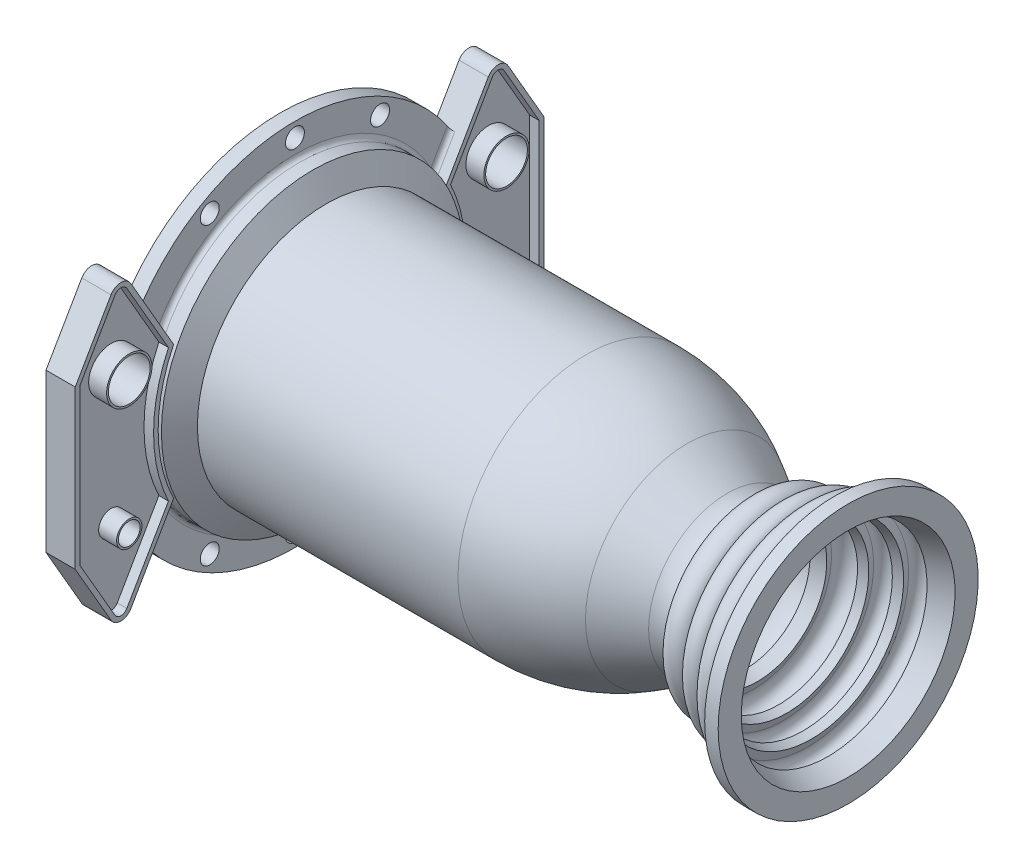
from build123d import *
from build123d.topology import SkipClean

# Parameters (mm, degrees)
BOSS_EXTRUDE1_DEPTH     = 16.256
CUT_EXTRUDE1_DEPTH      = 5.334
BOSS_EXTRUDE2_START     = -8.128
BOSS_EXTRUDE2_DEPTH     = 8.128
FILLET2_R               = 2.54
SKETCH9_R               = 5.275
CUT_EXTRUDE2_DEPTH      = 419.885269444
SKETCH10_R              = 11.6
SKETCH10_R_2            = 6.05
CUT_EXTRUDE3_DEPTH      = 417.321354466
BOSS_EXTRUDE3_START     = 10
SKETCH11_R              = 12.6
SKETCH11_R_2            = 11.6
SKETCH11_R_3            = 7.05
SKETCH11_R_4            = 6.05
BOSS_EXTRUDE3_DEPTH     = 10
CUT_EXTRUDE4_DEPTH      = 404.084600433
CUT_EXTRUDE4_DEPTH_BACK = 404.084600433
SKETCH17_W              = 85
SKETCH17_H              = 190


with BuildPart() as part:
    # Sketch3 → Revolve1 (revolve)
    with BuildSketch(Plane.XY):
        with BuildLine():
            Line((0, 71.5011717), (144.934666475, 71.5011717))
            ThreePointArc((144.934666475, 71.5011717), (173.892574508, 67.688769671), (200.877042723, 56.51141211))
            Line((200.877042723, 56.51141211), (223.127154881, 43.665279514))
            ThreePointArc((223.127154881, 43.665279514), (227.625034583, 41.721337074), (232.448772375, 40.860298318))
            add(Edge.make_bspline(
                [(232.448772375, 40.860298318), (234.86856203, 41.933657894), (240.173238318, 44.266655644), (251.176182965, 49.013937562), (265.440009786, 54.97345202), (282.448229164, 61.765962568), (299.354503113, 68.202057856), (316.156963457, 74.280596731), (332.857651733, 80.001884245), (346.685594207, 84.470267584), (357.704525634, 87.868146407), (363.182392167, 89.503083437), (365.9308663, 90.309661005)],
                knots=[0.492875979, 0.492875979, 0.492875979, 0.492875979, 0.492966882, 0.493074775, 0.493290561, 0.493506346, 0.493722132, 0.493937918, 0.494153704, 0.494369489, 0.494477382, 0.494585275, 0.494585275, 0.494585275, 0.494585275], degree=3))
            Line((365.9308663, 90.309661005), (367.338810321, 85.511985147))
            add(Edge.make_bspline(
                [(233.424633311, 35.822756061), (236.183141196, 37.049408729), (241.820242455, 39.531718175), (253.12775411, 44.410404122), (267.331680592, 50.344882311), (284.265598042, 57.10770533), (301.095145103, 63.51457761), (317.818383555, 69.564442688), (334.43732724, 75.257710839), (348.19495997, 79.703362784), (359.156425704, 83.083517043), (364.604957844, 84.709698506), (367.338810321, 85.511985147)],
                knots=[0.492862754, 0.492862754, 0.492862754, 0.492862754, 0.492966882, 0.493074775, 0.493290561, 0.493506346, 0.493722132, 0.493937918, 0.494153704, 0.494369489, 0.494477382, 0.494585275, 0.494585275, 0.494585275, 0.494585275], degree=3))
            ThreePointArc((233.424633311, 35.822756061), (226.800103593, 36.756276843), (220.627157517, 39.335150973))
            Line((220.627157517, 39.335150973), (198.377039169, 52.181287144))
            ThreePointArc((198.377039169, 52.181287144), (172.598474463, 62.859141831), (144.9346606, 66.5011717))
            Line((144.9346606, 66.5011717), (0, 66.5011717))
            Line((0, 66.5011717), (0, 71.5011717))
        make_face()
    revolve(axis=Axis((0, 0, 0), (1, 0, 0)))

    # Sketch4 → Revolve5 (revolve)
    with BuildSketch(Plane.XY):
        Polygon((-25.4, 66.5011717), (-25.4, 84.2011717), (-7.332348419, 84.2011717), (0, 71.5011717), (0, 66.5011717), align=None)
    revolve(axis=Axis((0, 0, 0), (1, 0, 0)))

    # Sketch6 → Boss-Extrude1 (add)
    with SkipClean():  # the faces are left unmerged after this step: merging them gives an invalid solid
        with BuildSketch(Plane.ZY.offset(25.4)):
            with BuildLine():
                Line((64.197098299, 17.35333995), (99.428641487, 78.37616278))
                ThreePointArc((99.428641487, 78.37616278), (104.927902801, 81.55116278), (110.427164115, 78.37616278))
                Line((110.427164115, 78.37616278), (130.327902801, 43.907072268))
                Line((130.327902801, 43.907072268), (130.327902801, -43.907072268))
                Line((130.327902801, -43.907072268), (110.427164115, -78.37616278))
                ThreePointArc((110.427164115, -78.37616278), (104.927902801, -81.55116278), (99.428641487, -78.37616278))
                Line((99.428641487, -78.37616278), (64.197098299, -17.35333995))
                ThreePointArc((64.197098299, -17.35333995), (66.5011717, 0), (64.197098299, 17.35333995))
            make_face()
            with BuildLine():
                Line((-64.197098299, -17.35333995), (-99.428641487, -78.37616278))
                ThreePointArc((-99.428641487, -78.37616278), (-104.927902801, -81.55116278), (-110.427164115, -78.37616278))
                Line((-110.427164115, -78.37616278), (-130.327902801, -43.907072268))
                Line((-130.327902801, -43.907072268), (-130.327902801, 43.907072268))
                Line((-130.327902801, 43.907072268), (-110.427164115, 78.37616278))
                ThreePointArc((-110.427164115, 78.37616278), (-104.927902801, 81.55116278), (-99.428641487, 78.37616278))
                Line((-99.428641487, 78.37616278), (-64.197098299, 17.35333995))
                ThreePointArc((-64.197098299, 17.35333995), (-66.5011717, 0), (-64.197098299, -17.35333995))
            make_face()
        extrude(amount=-BOSS_EXTRUDE1_DEPTH)

    # Sketch7 → Cut-Extrude1 (cut)
    with SkipClean():  # the faces are left unmerged after this step: merging them gives an invalid solid
        with BuildSketch(Plane(origin=(-9.144, 0, 0), x_dir=(0, 0, -1), z_dir=(1, 0, 0))):
            with BuildLine():
                Line((-78.462562562, 36.981848846), (-101.628346013, 77.10616278))
                ThreePointArc((-101.628346013, 77.10616278), (-104.927902801, 79.01116278), (-108.22745959, 77.10616278))
                Line((-108.22745959, 77.10616278), (-127.787902801, 43.226481319))
                Line((-127.787902801, 43.226481319), (-127.787902801, -43.226481319))
                Line((-127.787902801, -43.226481319), (-108.22745959, -77.10616278))
                ThreePointArc((-108.22745959, -77.10616278), (-104.927902801, -79.01116278), (-101.628346013, -77.10616278))
                Line((-101.628346013, -77.10616278), (-78.462562562, -36.981848846))
                ThreePointArc((-78.462562562, -36.981848846), (-86.7411717, 0), (-78.462562562, 36.981848846))
            make_face()
            with BuildLine():
                Line((101.628346013, -77.10616278), (78.462562562, -36.981848846))
                ThreePointArc((78.462562562, -36.981848846), (86.7411717, 0), (78.462562562, 36.981848846))
                Line((78.462562562, 36.981848846), (101.628346013, 77.10616278))
                ThreePointArc((101.628346013, 77.10616278), (104.927902801, 79.01116278), (108.22745959, 77.10616278))
                Line((108.22745959, 77.10616278), (127.787902801, 43.226481319))
                Line((127.787902801, 43.226481319), (127.787902801, -43.226481319))
                Line((127.787902801, -43.226481319), (108.22745959, -77.10616278))
                ThreePointArc((108.22745959, -77.10616278), (104.927902801, -79.01116278), (101.628346013, -77.10616278))
            make_face()
        extrude(amount=-CUT_EXTRUDE1_DEPTH, mode=Mode.SUBTRACT)

    # Sketch8 → Boss-Extrude2 (add)
    with SkipClean():  # the faces are left unmerged after this step: merging them gives an invalid solid
        with BuildSketch(Plane.ZY.offset(25.4).offset(BOSS_EXTRUDE2_START)):
            with BuildLine():
                Line((-75.592096587, 37.090055935), (-86.329826389, 55.688349511))
                ThreePointArc((-86.329826389, 55.688349511), (0, 102.7328146), (86.329826389, 55.688349511))
                Line((86.329826389, 55.688349511), (75.592096587, 37.090055935))
                ThreePointArc((75.592096587, 37.090055935), (0, 84.2011717), (-75.592096587, 37.090055935))
            make_face()
            with BuildLine():
                Line((86.329826389, -55.688349511), (75.592096587, -37.090055935))
                ThreePointArc((75.592096587, -37.090055935), (0, -84.2011717), (-75.592096587, -37.090055935))
                Line((-75.592096587, -37.090055935), (-86.329826389, -55.688349511))
                ThreePointArc((-86.329826389, -55.688349511), (0, -102.7328146), (86.329826389, -55.688349511))
            make_face()
        extrude(amount=BOSS_EXTRUDE2_DEPTH)

    # Fillet2
    fillet2_edges = [part.edges().sort_by_distance(p)[0] for p in [
        (-17.272, 46.389202723, 80.960961488),
        (-17.272, 71.459301297, 44.535441771),
        (-17.272, 46.389202723, -80.960961488),
        (-17.272, -46.389202723, -80.960961488),
        (-17.272, -84.2011717, 0),
        (-17.272, -46.389202723, 80.960961488),
    ]]
    fillet(fillet2_edges, radius=FILLET2_R)

    # Sketch9 → Cut-Extrude2 (cut, through all)
    with SkipClean():  # the faces are left unmerged after this step: merging them gives an invalid solid
        with BuildSketch(Plane(origin=(-17.272, 0, 0), x_dir=(0, 0, -1), z_dir=(1, 0, 0))):
            with Locations((0, 94.73699315)):
                Circle(SKETCH9_R)
            with Locations((-47.368496575, 82.044642746)):
                Circle(SKETCH9_R)
            with Locations((47.368496575, 82.044642746)):
                Circle(SKETCH9_R)
            with Locations((47.368496575, -82.044642746)):
                Circle(SKETCH9_R)
            with Locations((0, -94.73699315)):
                Circle(SKETCH9_R)
            with Locations((-47.368496575, -82.044642746)):
                Circle(SKETCH9_R)
        extrude(amount=-CUT_EXTRUDE2_DEPTH, mode=Mode.SUBTRACT)

    # Sketch10 → Cut-Extrude3 (cut, through all)
    with SkipClean():  # the faces are left unmerged after this step: merging them gives an invalid solid
        with BuildSketch(Plane(origin=(-14.478, 0, 0), x_dir=(0, 0, -1), z_dir=(1, 0, 0))):
            with Locations((-104.927902801, 36.981848846)):
                Circle(SKETCH10_R)
            with Locations((-104.927902801, -36.981848846)):
                Circle(SKETCH10_R_2)
            with Locations((104.927902801, -36.981848846)):
                Circle(SKETCH10_R_2)
            with Locations((104.927902801, 36.981848846)):
                Circle(SKETCH10_R)
        extrude(amount=-CUT_EXTRUDE3_DEPTH, mode=Mode.SUBTRACT)

    # Sketch11 → Boss-Extrude3 (add)
    # profile 1 of 4: a face of its own
    with SkipClean():  # the faces are left unmerged after this step: merging them gives an invalid solid
        with BuildSketch(Plane(origin=(-14.478, 0, 0), x_dir=(0, 0, -1), z_dir=(1, 0, 0)).offset(BOSS_EXTRUDE3_START)):
            with Locations((-104.927902801, 36.981848846)):
                Circle(SKETCH11_R)
            with Locations((-104.927902801, 36.981848846)):
                Circle(SKETCH11_R_2, mode=Mode.SUBTRACT)
        # profile 2 of 4: a face of its own
        with BuildSketch(Plane(origin=(-14.478, 0, 0), x_dir=(0, 0, -1), z_dir=(1, 0, 0)).offset(BOSS_EXTRUDE3_START)):
            with Locations((-104.927902801, -36.981848846)):
                Circle(SKETCH11_R_3)
            with Locations((-104.927902801, -36.981848846)):
                Circle(SKETCH11_R_4, mode=Mode.SUBTRACT)
        # profile 3 of 4: a face of its own
        with BuildSketch(Plane(origin=(-14.478, 0, 0), x_dir=(0, 0, -1), z_dir=(1, 0, 0)).offset(BOSS_EXTRUDE3_START)):
            with Locations((104.927902801, -36.981848846)):
                Circle(SKETCH11_R_3)
            with Locations((104.927902801, -36.981848846)):
                Circle(SKETCH11_R_4, mode=Mode.SUBTRACT)
        # profile 4 of 4: a face of its own
        with BuildSketch(Plane(origin=(-14.478, 0, 0), x_dir=(0, 0, -1), z_dir=(1, 0, 0)).offset(BOSS_EXTRUDE3_START)):
            with Locations((104.927902801, 36.981848846)):
                Circle(SKETCH11_R)
            with Locations((104.927902801, 36.981848846)):
                Circle(SKETCH11_R_2, mode=Mode.SUBTRACT)
        extrude(amount=-BOSS_EXTRUDE3_DEPTH)

    # Sketch17 → Cut-Extrude4 (cut, two sides: drawn at the far end of the back side and taken through both)
    with SkipClean():  # the faces are left unmerged after this step: merging them gives an invalid solid
        with BuildSketch(Plane.XY.offset(-CUT_EXTRUDE4_DEPTH_BACK)):
            with Locations((332.986, 0)):
                Rectangle(SKETCH17_W, SKETCH17_H)
        extrude(amount=CUT_EXTRUDE4_DEPTH + CUT_EXTRUDE4_DEPTH_BACK, mode=Mode.SUBTRACT)

    # Sketch18 → Revolve7 (revolve)
    with SkipClean():  # the faces are left unmerged after this step: merging them gives an invalid solid
        with BuildSketch(Plane.XY):
            with BuildLine():
                Line((290.486, 64.812548202), (290.486, 72.312548202))
                Line((290.486, 72.312548202), (282.986, 72.312548202))
                Line((282.986, 72.312548202), (282.986, 61.922779567))
                add(Edge.make_bspline(
                    [(290.486, 64.812548202), (287.989354003, 63.860960223), (285.489344982, 62.897698501), (282.986, 61.922779567)],
                    knots=[0.493835272, 0.493835272, 0.493835272, 0.493835272, 0.493930858, 0.493930858, 0.493930858, 0.493930858], degree=3))
            make_face()
        revolve(axis=Axis((0, 0, 0), (1, 0, 0)))

    # Sketch13 → Revolve6 (revolve)
    with SkipClean():  # the faces are left unmerged after this step: merging them gives an invalid solid
        with BuildSketch(Plane.XY):
            with BuildLine():
                Line((253.452894778, 49.926348503), (264.534326054, 54.53089852))
                ThreePointArc((264.534326054, 54.53089852), (256.691335407, 57.76933915), (253.452894778, 49.926348503))
            make_face()
            with BuildLine():
                Line((237.023320854, 42.878591235), (250.795528896, 48.822161344))
                ThreePointArc((250.795528896, 48.822161344), (240.940832573, 52.729082189), (237.023320854, 42.878591235))
            make_face()
            with BuildLine():
                Line((267.191691936, 55.635085679), (278.330896767, 60.097947001))
                ThreePointArc((278.330896767, 60.097947001), (270.524021325, 63.450701173), (267.191691936, 55.635085679))
            make_face()
        revolve(axis=Axis((0, 0, 0), (1, 0, 0)))

    # Sketch19 → Cut-Revolve1 (revolve, cut)
    with SkipClean():  # the faces are left unmerged after this step: merging them gives an invalid solid
        with BuildSketch(Plane.XY):
            with BuildLine():
                Line((237.945882089, 43.276734224), (239.927073237, 38.685995544))
                Line((239.927073237, 38.685995544), (251.858576099, 43.835186012))
                Line((251.858576099, 43.835186012), (249.87738495, 48.425924692))
                ThreePointArc((249.87738495, 48.425924692), (241.337038285, 51.817080889), (237.945882089, 43.276734224))
            make_face()
            with BuildLine():
                Line((254.369480154, 50.326707657), (256.288102902, 45.709469657))
                Line((256.288102902, 45.709469657), (265.522539081, 49.546698605))
                Line((265.522539081, 49.546698605), (263.603916333, 54.163936606))
                ThreePointArc((263.603916333, 54.163936606), (257.06808377, 56.862540221), (254.369480154, 50.326707657))
            make_face()
            with BuildLine():
                Line((268.119943937, 56.006984653), (270.150419973, 50.938960768))
                Line((270.150419973, 50.938960768), (279.433098433, 54.658015095))
                Line((279.433098433, 54.658015095), (277.402622398, 59.72603898))
                ThreePointArc((277.402622398, 59.72603898), (270.901756004, 62.507851047), (268.119943937, 56.006984653))
            make_face()
        revolve(axis=Axis((0, 0, 0), (1, 0, 0)), mode=Mode.SUBTRACT)


solid = part.part
